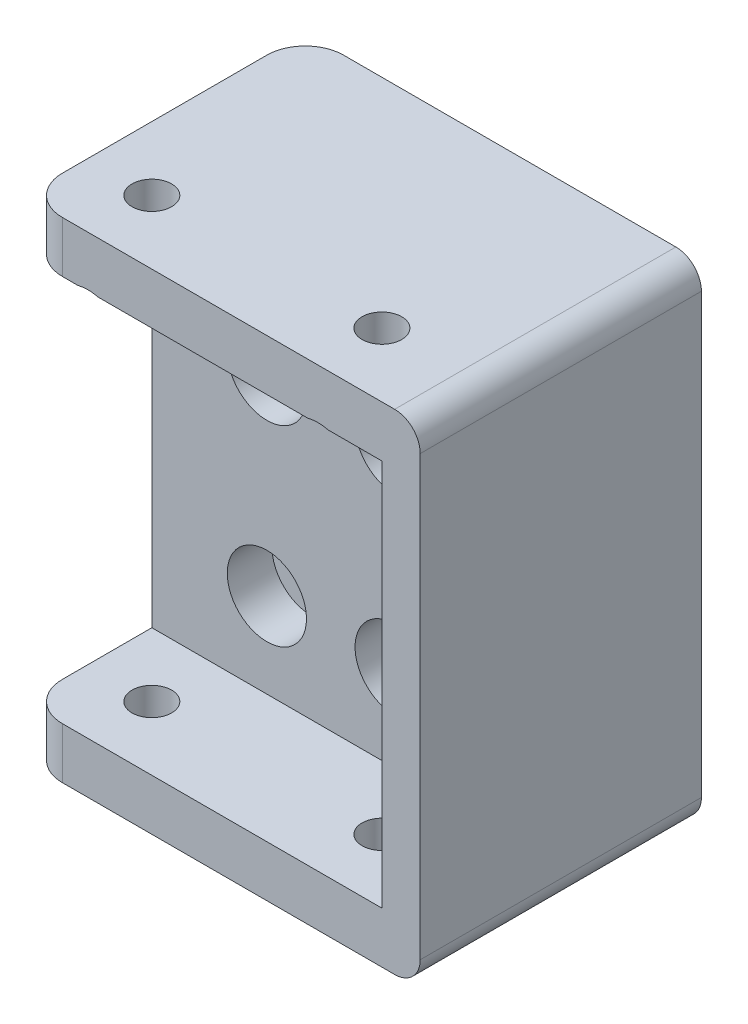
from build123d import *

# Parameters (mm, degrees)
SKETCH_1_W               = 28
SKETCH_1_H               = 20.3
SKETCH_1_R               = 1.5
EXTRUDE_1_DEPTH          = 5
SKETCH_2_W               = 28
SKETCH_2_H               = 6
SKETCH_2_H_2             = 4
EXTRUDE_2_DEPTH          = 10
SKETCH_3_W               = 28
SKETCH_3_H               = 6
EXTRUDE_3_DEPTH          = 5
SKETCH_4_R               = 1.5
CUT_EXTRUDE_1_DEPTH      = 27.11173108
SKETCH_5_W               = 10
SKETCH_5_H               = 6
SKETCH_5_W_2             = 5
SKETCH_5_H_2             = 4
CUT_EXTRUDE_2_DEPTH      = 34.835225727
SKETCH_6_W               = 28
SKETCH_6_H               = 30.3
CUT_EXTRUDE_3_DEPTH      = 1
EXTRUDE_4_DEPTH          = 12
EXTRUDE_4_DEPTH_BACK     = 10
SKETCH_7_W               = 28
SKETCH_7_H               = 4
CUT_EXTRUDE_4_DEPTH      = 28.313412456
CUT_EXTRUDE_4_DEPTH_BACK = 1.5
SKETCH_9_R               = 3.1
SKETCH_9_R_2             = 1.5
CUT_EXTRUDE_5_DEPTH      = 41.354553646
CUT_EXTRUDE_5_DEPTH_BACK = 41.354553646
SKETCH_10_R              = 1.55
SKETCH_11_W              = 22
SKETCH_11_H              = 38.3
EXTRUDE_5_DEPTH          = 3
FILLET_1_R               = 2
FILLET_2_R               = 3
EXTRUDE_START            = 2
SKETCH_13_R              = 3.1
EXTRUDE_6_DEPTH          = 2


with BuildPart() as part:
    # 草图1 → 凸台-拉伸1 (new body)
    with BuildSketch(Plane.XY):
        Rectangle(SKETCH_1_W, SKETCH_1_H)
        with Locations((-5, 7.5)):
            Circle(SKETCH_1_R, mode=Mode.SUBTRACT)
        with Locations((5, 7.5)):
            Circle(SKETCH_1_R, mode=Mode.SUBTRACT)
        with Locations((5, -7.5)):
            Circle(SKETCH_1_R, mode=Mode.SUBTRACT)
        with Locations((-5, -7.5)):
            Circle(SKETCH_1_R, mode=Mode.SUBTRACT)
    extrude(amount=EXTRUDE_1_DEPTH)

    # 草图2 → 凸台-拉伸2 (add)
    with BuildSketch(Plane.XY.offset(5)):
        with Locations((0, 13.15)):
            Rectangle(SKETCH_2_W, SKETCH_2_H)
        with Locations((0, -12.15)):
            Rectangle(SKETCH_2_W, SKETCH_2_H_2)
    extrude(amount=-EXTRUDE_2_DEPTH)

    # 草图3 → 凸台-拉伸3 (add)
    with BuildSketch(Plane(origin=(0, 0, -5), x_dir=(-1, 0, 0), z_dir=(0, 0, -1))):
        with Locations((0, 13.15)):
            Rectangle(SKETCH_3_W, SKETCH_3_H)
    extrude(amount=EXTRUDE_3_DEPTH)

    # 草图4 → 切除-拉伸1 (cut, through all)
    with BuildSketch(Plane.XY.offset(5)):
        with Locations((-9, 13.15)):
            Circle(SKETCH_4_R)
        with Locations((9, 13.15)):
            Circle(SKETCH_4_R)
    extrude(amount=-CUT_EXTRUDE_1_DEPTH, mode=Mode.SUBTRACT)

    # 草图5 → 切除-拉伸2 (cut, through all)
    with BuildSketch(Plane.ZY.offset(14)):
        with Locations((-5, 13.15)):
            Rectangle(SKETCH_5_W, SKETCH_5_H)
        with Locations((-2.5, -12.15)):
            Rectangle(SKETCH_5_W_2, SKETCH_5_H_2)
    extrude(amount=-CUT_EXTRUDE_2_DEPTH, mode=Mode.SUBTRACT)

    # 草图6 → 切除-拉伸3 (cut)
    with BuildSketch(Plane.XY.offset(5)):
        with Locations((0, 1)):
            Rectangle(SKETCH_6_W, SKETCH_6_H)
    extrude(amount=-CUT_EXTRUDE_3_DEPTH, mode=Mode.SUBTRACT)

    # 草图7 → 凸台-拉伸4 (add, two sides: drawn at the far end of the back side and taken through both)
    with BuildSketch(Plane.XY.offset(4).offset(-EXTRUDE_4_DEPTH_BACK)):
        with Locations((0, -16.15)):
            Rectangle(SKETCH_7_W, SKETCH_7_H)
        with Locations((0, 18.15)):
            Rectangle(SKETCH_7_W, SKETCH_7_H)
    extrude(amount=EXTRUDE_4_DEPTH + EXTRUDE_4_DEPTH_BACK)

    # 草图9 → 切除-拉伸4 (cut, two sides: drawn at the far end of the back side and taken through both)
    # profile 1 of 6: a face of its own
    with BuildSketch(Plane.XY.offset(4).offset(-CUT_EXTRUDE_4_DEPTH_BACK)):
        with Locations((-9, 13.15)):
            Circle(SKETCH_9_R)
        with Locations((-9, 13.15)):
            Circle(SKETCH_9_R_2, mode=Mode.SUBTRACT)
    # profile 2 of 6: a face of its own
    with BuildSketch(Plane.XY.offset(4).offset(-CUT_EXTRUDE_4_DEPTH_BACK)):
        with Locations((-5, 7.5)):
            Circle(SKETCH_9_R)
        with Locations((-5, 7.5)):
            Circle(SKETCH_9_R_2, mode=Mode.SUBTRACT)
    # profile 3 of 6: a face of its own
    with BuildSketch(Plane.XY.offset(4).offset(-CUT_EXTRUDE_4_DEPTH_BACK)):
        with Locations((5, 7.5)):
            Circle(SKETCH_9_R)
        with Locations((5, 7.5)):
            Circle(SKETCH_9_R_2, mode=Mode.SUBTRACT)
    # profile 4 of 6: a face of its own
    with BuildSketch(Plane.XY.offset(4).offset(-CUT_EXTRUDE_4_DEPTH_BACK)):
        with Locations((9, 13.15)):
            Circle(SKETCH_9_R)
        with Locations((9, 13.15)):
            Circle(SKETCH_9_R_2, mode=Mode.SUBTRACT)
    # profile 5 of 6: a face of its own
    with BuildSketch(Plane.XY.offset(4).offset(-CUT_EXTRUDE_4_DEPTH_BACK)):
        with Locations((5, -7.5)):
            Circle(SKETCH_9_R)
        with Locations((5, -7.5)):
            Circle(SKETCH_9_R_2, mode=Mode.SUBTRACT)
    # profile 6 of 6: a face of its own
    with BuildSketch(Plane.XY.offset(4).offset(-CUT_EXTRUDE_4_DEPTH_BACK)):
        with Locations((-5, -7.5)):
            Circle(SKETCH_9_R)
        with Locations((-5, -7.5)):
            Circle(SKETCH_9_R_2, mode=Mode.SUBTRACT)
    extrude(amount=CUT_EXTRUDE_4_DEPTH + CUT_EXTRUDE_4_DEPTH_BACK, mode=Mode.SUBTRACT)

    # 草图10 → 切除-拉伸5 (cut, two sides: drawn at the far end of the back side and taken through both)
    with BuildSketch(Plane(origin=(0, -14.15, 0), x_dir=(1, 0, 0), z_dir=(0, 1, 0)).offset(-CUT_EXTRUDE_5_DEPTH_BACK)):
        with Locations((-9, -11)):
            Circle(SKETCH_10_R)
        with Locations((9, -11)):
            Circle(SKETCH_10_R)
    extrude(amount=CUT_EXTRUDE_5_DEPTH + CUT_EXTRUDE_5_DEPTH_BACK, mode=Mode.SUBTRACT)

    # 草图11 → 凸台-拉伸5 (add)
    with BuildSketch(Plane(origin=(14, 0, 0), x_dir=(0, 0, -1), z_dir=(1, 0, 0))):
        with Locations((-5, 1)):
            Rectangle(SKETCH_11_W, SKETCH_11_H)
    extrude(amount=EXTRUDE_5_DEPTH)

    # 圆角1
    fillet_1_edges = [part.edges().sort_by_distance(p)[0] for p in [
        (17, -18.15, 5),
        (17, 20.15, 5),
    ]]
    fillet(fillet_1_edges, radius=FILLET_1_R)

    # 圆角2
    fillet_2_edges = [part.edges().sort_by_distance(p)[0] for p in [
        (-14, 18.15, 16),
        (-14, -16.15, 16),
        (-14, 18.15, -6),
        (-14, -16.15, -6),
    ]]
    fillet(fillet_2_edges, radius=FILLET_2_R)

    # 草图13 → 凸台-拉伸6 (add)
    with BuildSketch(Plane.XY.offset(4).offset(EXTRUDE_START)):
        with BuildLine():
            Line((14, 16.15), (9.781024968, 16.15))
            ThreePointArc((9.781024968, 16.15), (9, 10.05), (8.218975032, 16.15))
            Line((8.218975032, 16.15), (-8.218975032, 16.15))
            ThreePointArc((-8.218975032, 16.15), (-9, 10.05), (-9.781024968, 16.15))
            Line((-9.781024968, 16.15), (-14, 16.15))
            Line((-14, 16.15), (-14, -14.15))
            Line((-14, -14.15), (14, -14.15))
            Line((14, -14.15), (14, 16.15))
        make_face()
        with Locations((5, -7.5)):
            Circle(SKETCH_13_R, mode=Mode.SUBTRACT)
        with Locations((-5, -7.5)):
            Circle(SKETCH_13_R, mode=Mode.SUBTRACT)
        with Locations((5, 7.5)):
            Circle(SKETCH_13_R, mode=Mode.SUBTRACT)
        with Locations((-5, 7.5)):
            Circle(SKETCH_13_R, mode=Mode.SUBTRACT)
    extrude(amount=-EXTRUDE_6_DEPTH)


solid = part.part
